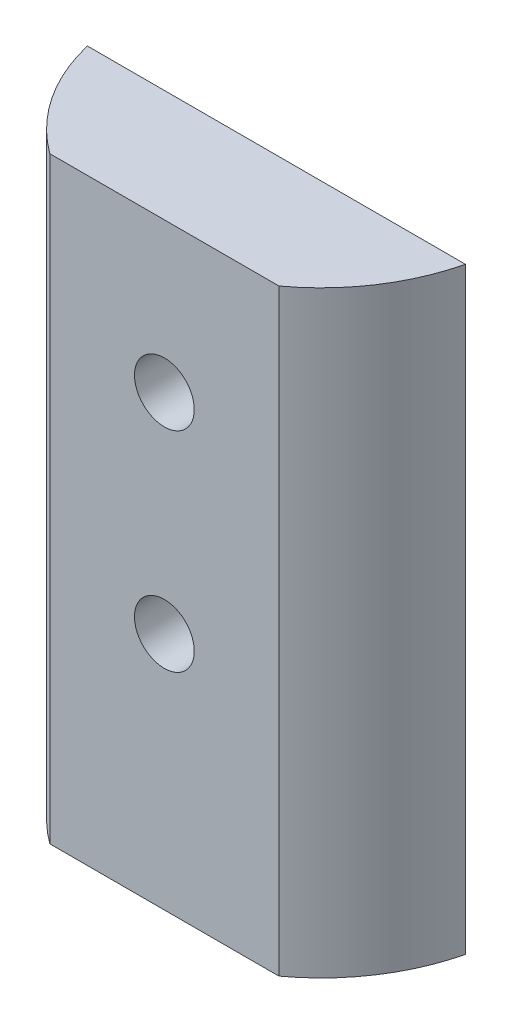
from build123d import *

# Parameters (mm, degrees)
EXTRUDE_1_DEPTH     = 20
SKETCH_3_R          = 1
CUT_EXTRUDE_1_DEPTH = 20


with BuildPart() as part:
    # 草图2 → 凸台-拉伸1 (new body)
    with BuildSketch(Plane(origin=(0, 0, 0), x_dir=(1, 0, 0), z_dir=(0, 1, 0))):
        with BuildLine():
            Line((6.32455532, -1.5), (-6.32455532, -1.5))
            ThreePointArc((-6.32455532, -1.5), (-5.413566259, -3.597679857), (-3.832427429, -5.25))
            Line((-3.832427429, -5.25), (3.832427429, -5.25))
            ThreePointArc((3.832427429, -5.25), (5.413566259, -3.597679857), (6.32455532, -1.5))
        make_face()
    extrude(amount=EXTRUDE_1_DEPTH)

    # 草图3 → 切除-拉伸1 (cut)
    with BuildSketch(Plane.XY.offset(5.25)):
        with Locations((0, 15)):
            Circle(SKETCH_3_R)
        with Locations((0, 8)):
            Circle(SKETCH_3_R)
    extrude(amount=-CUT_EXTRUDE_1_DEPTH, mode=Mode.SUBTRACT)


solid = part.part
